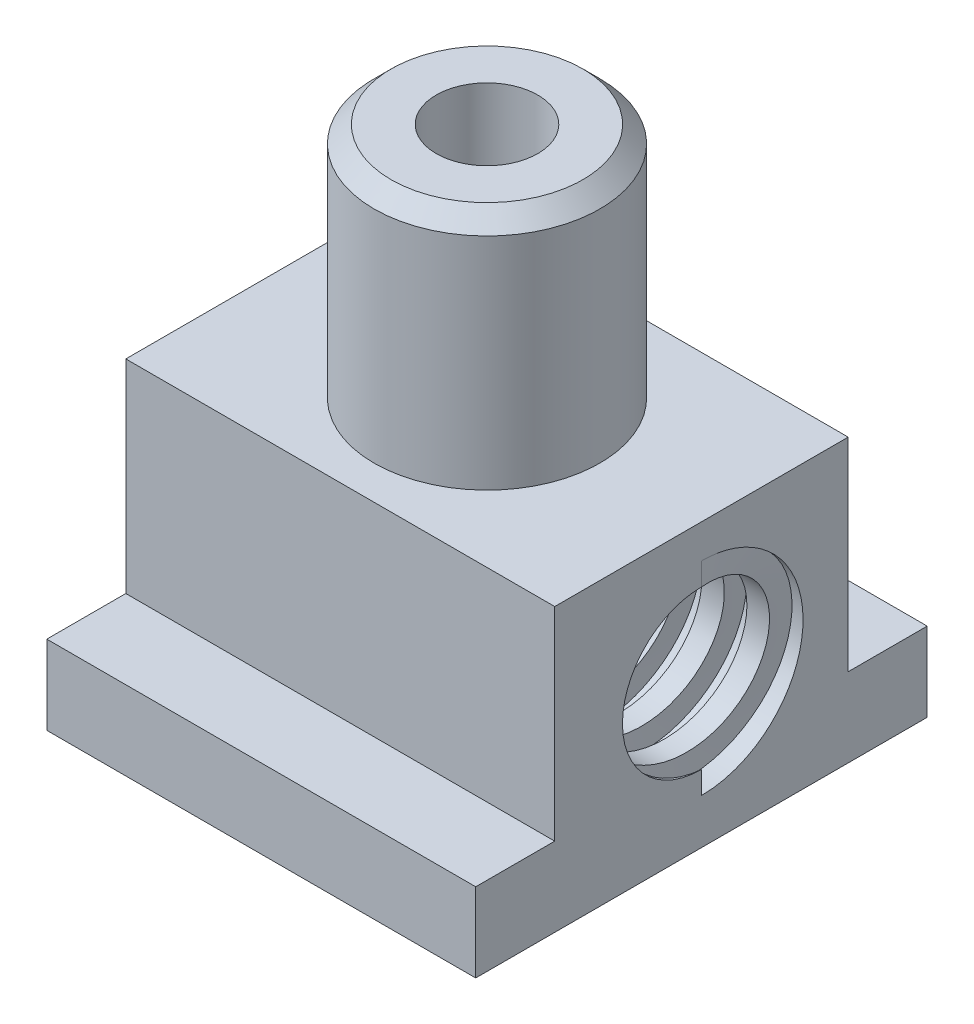
from build123d import *

# Parameters (mm, degrees)
EXTRUDE_1_DEPTH     = 19
SKETCH_3_R          = 7
CUT_EXTRUDE_1_DEPTH = 50.689032995
SKETCH_4_R          = 10
EXTRUDE_2_DEPTH     = 21
CHAMFER_1_SIZE      = 1.5
M10X1_0_1_D         = 9
M10X1_0_1_DEPTH     = 22
M10X1_0_1_TIP       = 2.703872786
SWEEP_2_PITCH       = 4


with BuildPart() as part:
    # 草图1 → 凸台-拉伸1 (new, symmetric)
    with BuildSketch(Plane(origin=(0, 0, 0), x_dir=(0, 0, -1), z_dir=(1, 0, 0))):
        Polygon((-20, 0), (20, 0), (20, 7), (13, 7), (13, 25), (-13, 25), (-13, 7), (-20, 7), align=None)
    extrude(amount=EXTRUDE_1_DEPTH, both=True)

    # 草图3 → 切除-拉伸1 (cut, through all)
    with BuildSketch(Plane.ZY.offset(19)):
        with Locations((0, 13)):
            Circle(SKETCH_3_R)
    extrude(amount=-CUT_EXTRUDE_1_DEPTH, mode=Mode.SUBTRACT)

    # 草图4 → 凸台-拉伸2 (add)
    with BuildSketch(Plane(origin=(0, 25, 0), x_dir=(1, 0, 0), z_dir=(0, 1, 0))):
        with Locations(Location((0, 0, 0), (0, 0, 90))):
            Circle(SKETCH_4_R)
    extrude(amount=EXTRUDE_2_DEPTH)

    # 倒角1
    chamfer_1_edges = [part.edges().sort_by_distance(p)[0] for p in [
        (0, 46, 10),
    ]]
    chamfer(chamfer_1_edges, length=CHAMFER_1_SIZE)

    # M10x1.0 螺纹孔1
    with Locations(Plane(origin=(0, 46, 0), x_dir=(-1, 0, 0), z_dir=(0, 1, 0))):
        with Locations((0, 0)):
            Hole(M10X1_0_1_D / 2, depth=M10X1_0_1_DEPTH)
            with Locations((0, 0, -(M10X1_0_1_DEPTH + M10X1_0_1_TIP / 2))):  # 118° drill point
                Cone(0, M10X1_0_1_D / 2, M10X1_0_1_TIP, mode=Mode.SUBTRACT)

    # 切除-扫描2: arcs per turn and ends read off the stored shape
    # 切除-扫描2: the profile of 草图9 profile screwed along a right-hand helix through 11 turns, 12 arcs to a turn; built about Z, then put on its axis
    sweep_2_z = Axis((0, 0, 0), (0, 0, 1))
    sweep_2_corners = [(9, 0, -5), (6.9997, 0, -5), (6.9997, 0, -3), (9, 0, -3)]
    with BuildLine(mode=Mode.PRIVATE) as sweep_2_profile:
        Line(sweep_2_corners[0], sweep_2_corners[1])
        Line(sweep_2_corners[1], sweep_2_corners[2])
        Line(sweep_2_corners[2], sweep_2_corners[3])
        Line(sweep_2_corners[3], sweep_2_corners[0])
    sweep_2_cap = Face(sweep_2_profile.wire())
    sweep_2_turn_angles = [0, 15, 30, 45, 60, 75, 90, 105, 120, 135, 150, 165, 180, 195, 210, 225, 240, 255, 270, 285, 300, 315, 330, 345, 360]
    sweep_2_turn_weights = [1, 0.9659258262890683, 1, 0.9659258262890683, 1, 0.9659258262890683, 1, 0.9659258262890683, 1, 0.9659258262890683, 1, 0.9659258262890683, 1, 0.9659258262890683, 1, 0.9659258262890683, 1, 0.9659258262890683, 1, 0.9659258262890683, 1, 0.9659258262890683, 1, 0.9659258262890683, 1]
    sweep_2_turn_rails = [Edge.make_bspline([Vector(p[0], p[1], 0).rotate(sweep_2_z, sweep_2_turn_angles[k]) / sweep_2_turn_weights[k] + Vector(0, 0, p[2] + SWEEP_2_PITCH * sweep_2_turn_angles[k] / 360) for k in range(25)], [0, 0, 0, 1, 1, 2, 2, 3, 3, 4, 4, 5, 5, 6, 6, 7, 7, 8, 8, 9, 9, 10, 10, 11, 11, 12, 12, 12], 2, sweep_2_turn_weights) for p in sweep_2_corners]
    sweep_2_turn_sides = [Face.make_surface_from_curves(sweep_2_turn_rails[p[0]], sweep_2_turn_rails[p[1]]) for p in [(0, 1), (1, 2), (2, 3), (3, 0)]]
    sweep_2 = Plane(origin=(19, 13, 0), x_dir=(0, 0, -1), z_dir=(-1, 0, 0)) * Solid(Shell([*[p.moved(Location((0, 0, SWEEP_2_PITCH * i))) for i in range(11) for p in sweep_2_turn_sides], sweep_2_cap, sweep_2_cap.rotate(sweep_2_z, 3960).moved(Location((0, 0, SWEEP_2_PITCH * 3960 / 360)))]))
    add(sweep_2, mode=Mode.SUBTRACT)


solid = part.part
